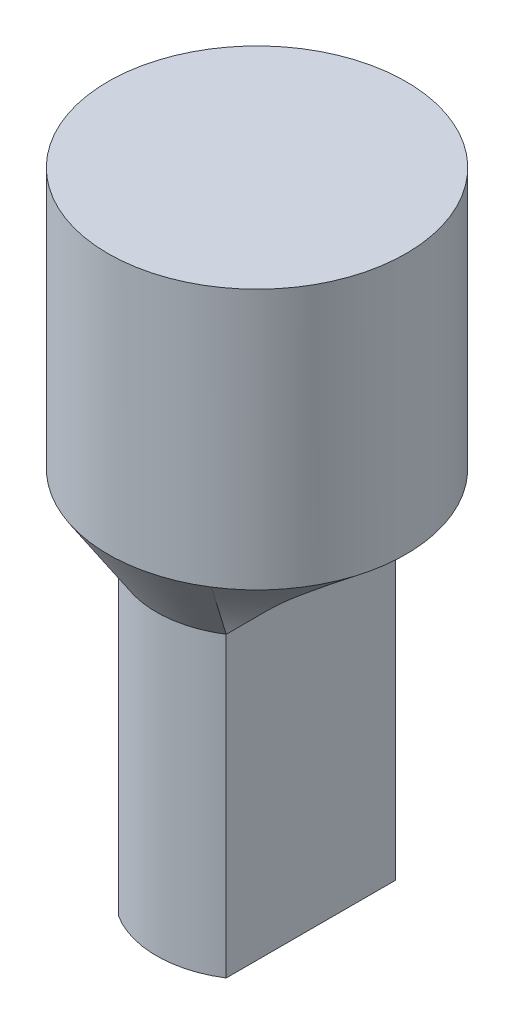
from build123d import *

# Parameters (mm, degrees)
BOSS_EXTRUDE1_DEPTH = 8
SKETCH4_2_R         = 4.005085862
BOSS_EXTRUDE2_DEPTH = 7


with BuildPart() as part:
    # Sketch2 → Boss-Extrude1 (new body)
    with BuildSketch(Plane(origin=(0, 0, 0), x_dir=(1, 0, 0), z_dir=(0, 1, 0))):
        with BuildLine():
            Line((-1.45, -2.277608395), (-1.45, 2.277608395))
            ThreePointArc((-1.45, 2.277608395), (0, 2.7), (1.45, 2.277608395))
            Line((1.45, 2.277608395), (1.45, -2.277608395))
            ThreePointArc((1.45, -2.277608395), (0, -2.7), (-1.45, -2.277608395))
        make_face()
    extrude(amount=BOSS_EXTRUDE1_DEPTH)

    # Loft1: read off the stored shape, not the designer's step
    # Loft1: loft between two sections, ruled curve by curve
    loft1_from = [
        Edge.make_bspline([(-2.150879444, 10, 3.378524882), (-2.388378106, 10, 3.227325466), (-2.624035514, 10, 3.04192179), (-3.065094821, 10, 2.596929783), (-3.270264421, 10, 2.337125185), (-3.618034511, 10, 1.751173832), (-3.760229719, 10, 1.425019575), (-3.95392679, 10, 0.73244199), (-4.005085862, 10, 0.366346071), (-4.005085862, 10, -0.366346071), (-3.95392679, 10, -0.73244199), (-3.760229719, 10, -1.425019575), (-3.618034511, 10, -1.751173832), (-3.270264421, 10, -2.337125185), (-3.065094821, 10, -2.596929783), (-2.624035514, 10, -3.04192179), (-2.388378106, 10, -3.227325466), (-2.150879444, 10, -3.378524882)], [0, 0, 0, 0, 0.125, 0.125, 0.25, 0.25, 0.375, 0.375, 0.5, 0.5, 0.625, 0.625, 0.75, 0.75, 0.875, 0.875, 1, 1, 1, 1], 3),
        Edge.make_bspline([(2.150879444, 10, -3.378524882), (2.388378106, 10, -3.227325466), (2.624035514, 10, -3.04192179), (3.065094821, 10, -2.596929783), (3.270264421, 10, -2.337125185), (3.618034511, 10, -1.751173832), (3.760229719, 10, -1.425019575), (3.95392679, 10, -0.73244199), (4.005085862, 10, -0.366346071), (4.005085862, 10, 0.366346071), (3.95392679, 10, 0.73244199), (3.760229719, 10, 1.425019575), (3.618034511, 10, 1.751173832), (3.270264421, 10, 2.337125185), (3.065094821, 10, 2.596929783), (2.624035514, 10, 3.04192179), (2.388378106, 10, 3.227325466), (2.150879444, 10, 3.378524882)], [0, 0, 0, 0, 0.125, 0.125, 0.25, 0.25, 0.375, 0.375, 0.5, 0.5, 0.625, 0.625, 0.75, 0.75, 0.875, 0.875, 1, 1, 1, 1], 3),
        Edge.make_three_point_arc((2.150879444, 10, -3.378524882), (0, 10, -4.005085862), (-2.150879444, 10, -3.378524882)),
        Edge.make_three_point_arc((-2.150879444, 10, 3.378524882), (0, 10, 4.005085862), (2.150879444, 10, 3.378524882)),
    ]
    loft1_to = [
        Edge.make_bspline([(-1.45, 8, 2.277608395), (-1.45, 8, 2.087807695), (-1.45, 8, 1.898006996), (-1.45, 8, 1.518405597), (-1.45, 8, 1.328604897), (-1.45, 8, 0.949003498), (-1.45, 8, 0.759202798), (-1.45, 8, 0.379601399), (-1.45, 8, 0.1898007), (-1.45, 8, -0.1898007), (-1.45, 8, -0.379601399), (-1.45, 8, -0.759202798), (-1.45, 8, -0.949003498), (-1.45, 8, -1.328604897), (-1.45, 8, -1.518405597), (-1.45, 8, -1.898006996), (-1.45, 8, -2.087807695), (-1.45, 8, -2.277608395)], [0, 0, 0, 0, 0.125, 0.125, 0.25, 0.25, 0.375, 0.375, 0.5, 0.5, 0.625, 0.625, 0.75, 0.75, 0.875, 0.875, 1, 1, 1, 1], 3),
        Edge.make_bspline([(1.45, 8, -2.277608395), (1.45, 8, -2.087807695), (1.45, 8, -1.898006996), (1.45, 8, -1.518405597), (1.45, 8, -1.328604897), (1.45, 8, -0.949003498), (1.45, 8, -0.759202798), (1.45, 8, -0.379601399), (1.45, 8, -0.1898007), (1.45, 8, 0.1898007), (1.45, 8, 0.379601399), (1.45, 8, 0.759202798), (1.45, 8, 0.949003498), (1.45, 8, 1.328604897), (1.45, 8, 1.518405597), (1.45, 8, 1.898006996), (1.45, 8, 2.087807695), (1.45, 8, 2.277608395)], [0, 0, 0, 0, 0.125, 0.125, 0.25, 0.25, 0.375, 0.375, 0.5, 0.5, 0.625, 0.625, 0.75, 0.75, 0.875, 0.875, 1, 1, 1, 1], 3),
        Edge.make_three_point_arc((1.45, 8, -2.277608395), (0, 8, -2.7), (-1.45, 8, -2.277608395)),
        Edge.make_three_point_arc((-1.45, 8, 2.277608395), (0, 8, 2.7), (1.45, 8, 2.277608395)),
    ]
    loft1 = Solid(Shell([*[Face.make_surface_from_curves(loft1_from[k], loft1_to[k]) for k in range(4)], Face(Wire(loft1_from)), Face(Wire(loft1_to))]))
    add(loft1)

    # Sketch4<2> → Boss-Extrude2 (add)
    with BuildSketch(Plane(origin=(0, 10, 0), x_dir=(1, 0, 0), z_dir=(0, 1, 0))):
        with Locations(Location((0, 0, 0), (0, 0, 122.482158535))):
            Circle(SKETCH4_2_R)
    extrude(amount=BOSS_EXTRUDE2_DEPTH)


solid = part.part
